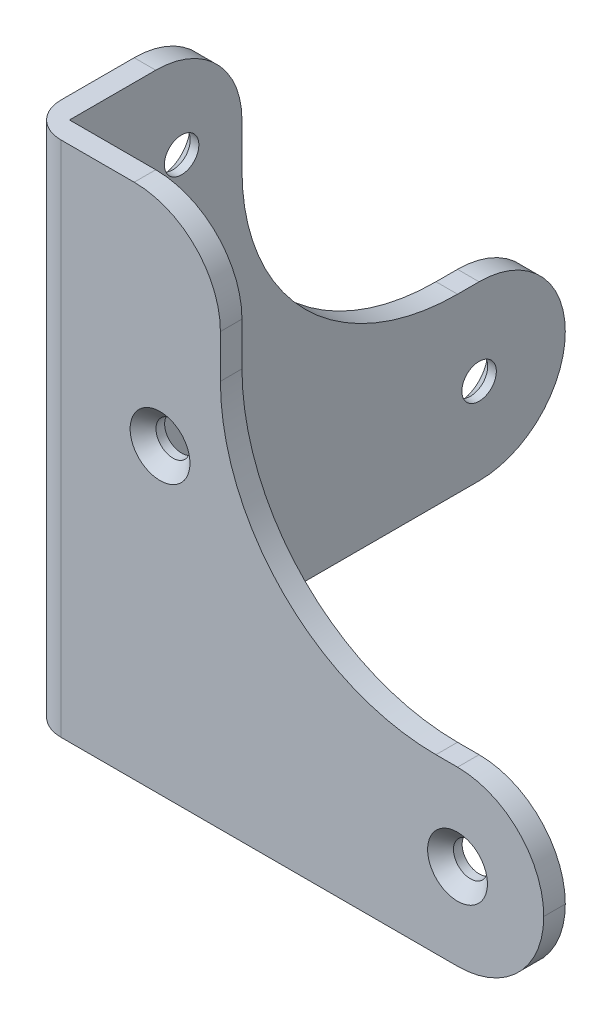
from build123d import *

# Parameters (mm, degrees)
BOSS_EXTRUDE1_DEPTH = 76.2
SKETCH2_W           = 47.625
SKETCH2_H           = 50.8
CUT_EXTRUDE1_DEPTH  = 131.175
SKETCH3_W           = 47.625
SKETCH3_H           = 50.8
CUT_EXTRUDE2_DEPTH  = 131.175
FILLET1_R           = 5.08
FILLET2_R           = 12.7
SKETCH4_R           = 2.5
CUT_EXTRUDE3_DEPTH  = 132.982271537
SKETCH5_R           = 2.54
CUT_EXTRUDE4_DEPTH  = 132.982271537
CHAMFER1_SIZE       = 1.905
FILLET3_R           = 31.75


with BuildPart() as part:
    # Sketch1 → Boss-Extrude1 (new body)
    with BuildSketch(Plane(origin=(0, 0, 0), x_dir=(1, 0, 0), z_dir=(0, 1, 0))):
        Polygon((0, 76.2), (0, 0), (76.2, 0), (76.2, 3.175), (3.175, 3.175), (3.175, 76.2), align=None)
    extrude(amount=BOSS_EXTRUDE1_DEPTH)

    # Sketch2 → Cut-Extrude1 (cut, through all)
    with BuildSketch(Plane(origin=(0, 0, -3.175), x_dir=(-1, 0, 0), z_dir=(0, 0, -1))):
        with Locations((-52.3875, 50.8)):
            Rectangle(SKETCH2_W, SKETCH2_H)
    extrude(amount=-CUT_EXTRUDE1_DEPTH, mode=Mode.SUBTRACT)

    # Sketch3 → Cut-Extrude2 (cut, through all)
    with BuildSketch(Plane(origin=(3.175, 0, 0), x_dir=(0, 0, -1), z_dir=(1, 0, 0))):
        with Locations((52.3875, 50.8)):
            Rectangle(SKETCH3_W, SKETCH3_H)
    extrude(amount=-CUT_EXTRUDE2_DEPTH, mode=Mode.SUBTRACT)

    # Fillet1
    fillet1_edges = [part.edges().sort_by_distance(p)[0] for p in [
        (0, 38.1, 0),
    ]]
    fillet(fillet1_edges, radius=FILLET1_R)

    # Fillet2
    fillet2_edges = [part.edges().sort_by_distance(p)[0] for p in [
        (1.5875, 76.2, -28.575),
        (1.5875, 25.4, -76.2),
        (1.5875, 0, -76.2),
        (76.2, 0, -1.5875),
        (76.2, 25.4, -1.5875),
        (28.575, 76.2, -1.5875),
    ]]
    fillet(fillet2_edges, radius=FILLET2_R - 0.0001)  # a hair under: the kernel refuses the full size

    # Sketch4 → Cut-Extrude3 (cut, through all)
    with BuildSketch(Plane.XY):
        with Locations((63.5, 12.7)):
            Circle(SKETCH4_R)
        with Locations((19.685, 44.45)):
            Circle(SKETCH4_R)
    extrude(amount=-CUT_EXTRUDE3_DEPTH, mode=Mode.SUBTRACT)

    # Sketch5 → Cut-Extrude4 (cut, through all)
    with BuildSketch(Plane.ZY):
        with Locations((-63.5, 12.7)):
            Circle(SKETCH5_R)
        with Locations((-19.685, 63.5)):
            Circle(SKETCH5_R)
    extrude(amount=-CUT_EXTRUDE4_DEPTH, mode=Mode.SUBTRACT)

    # Chamfer1
    chamfer1_edges = [part.edges().sort_by_distance(p)[0] for p in [
        (0, 63.5, -22.225),
        (61, 12.7, 0),
        (17.185, 44.45, 0),
        (0, 12.7, -66.04),
    ]]
    chamfer(chamfer1_edges, length=CHAMFER1_SIZE)

    # Fillet3
    fillet3_edges = [part.edges().sort_by_distance(p)[0] for p in [
        (28.575, 25.4, -1.5875),
        (1.5875, 25.4, -28.575),
    ]]
    fillet(fillet3_edges, radius=FILLET3_R)


solid = part.part
